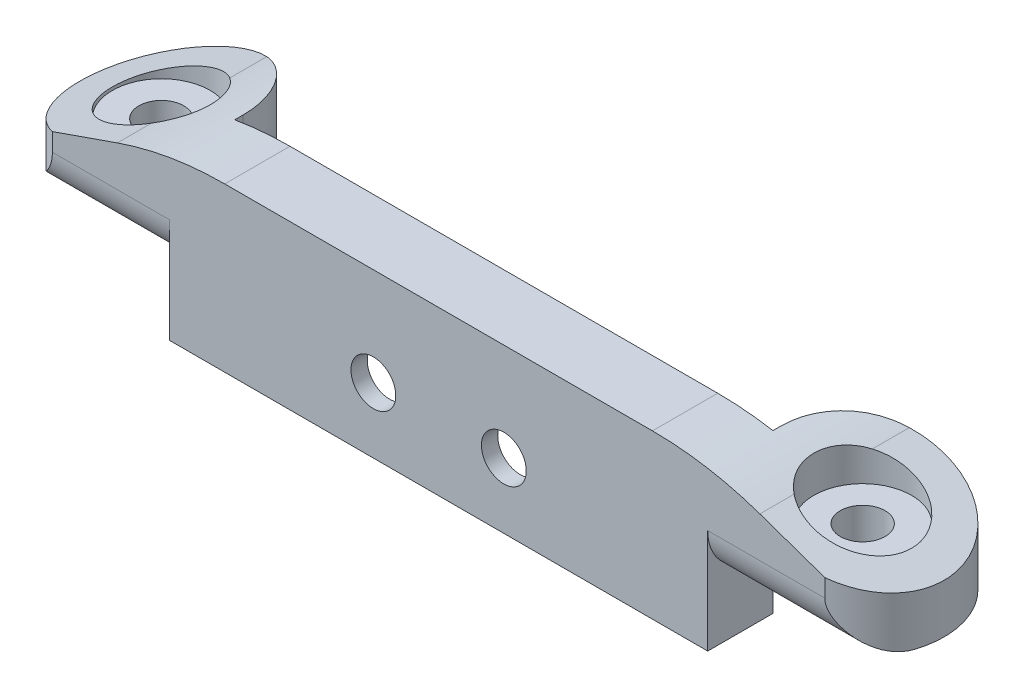
from build123d import *

# Parameters (mm, degrees)
SKETCH1_W               = 33
SKETCH1_H               = 20
BOSS_EXTRUDE1_DEPTH     = 4
BOSS_EXTRUDE2_START     = -13
BOSS_EXTRUDE2_DEPTH     = 13
FILLET2_R               = 5.8
CUT_EXTRUDE1_DEPTH      = 59.600341412
CUT_EXTRUDE1_DEPTH_BACK = 59.600341412
SKETCH3_R               = 2.75
CUT_EXTRUDE2_DEPTH      = 24.26
FILLET3_R               = 40
SKETCH5_R               = 6
CUT_EXTRUDE3_DEPTH      = 5.96
SKETCH7_W               = 48
SKETCH7_H               = 16
CUT_EXTRUDE6_DEPTH      = 6
FILLET4_R               = 8
FILLET5_R               = 2
CUT_EXTRUDE7_DEPTH      = 57.550862204
CUT_EXTRUDE7_DEPTH_BACK = 57.550862204
SKETCH8_R               = 2.75


with BuildPart() as part:
    # Sketch1 → Boss-Extrude1 (new, symmetric)
    with BuildSketch(Plane.XY):
        with Locations((16.5, 0)):
            Rectangle(SKETCH1_W, SKETCH1_H)
    extrude(amount=BOSS_EXTRUDE1_DEPTH, both=True)

    # Sketch2 → Boss-Extrude2 (add)
    with BuildSketch(Plane(origin=(0, 10, 0), x_dir=(1, 0, 0), z_dir=(0, 1, 0)).offset(BOSS_EXTRUDE2_START)):
        with BuildLine():
            Line((33, 5), (33, -4))
            Line((33, -4), (47.358898944, -4))
            ThreePointArc((47.358898944, -4), (48.310885546, 13.473163206), (33, 5))
        make_face()
    extrude(amount=BOSS_EXTRUDE2_DEPTH)

    # Fillet2
    fillet2_edges = [part.edges().sort_by_distance(p)[0] for p in [
        (40.179449472, -3, 4),
    ]]
    fillet(fillet2_edges, radius=FILLET2_R)

    # Sketch3 → Cut-Extrude1 (cut, two sides: drawn at the far end of the back side and taken through both)
    with BuildSketch(Plane(origin=(0, 10, 0), x_dir=(1, 0, 0), z_dir=(0, 1, 0)).offset(-CUT_EXTRUDE1_DEPTH_BACK)):
        with Locations(Location((43, 5, 0), (0, 0, 180))):
            Circle(SKETCH3_R)
    extrude(amount=CUT_EXTRUDE1_DEPTH + CUT_EXTRUDE1_DEPTH_BACK, mode=Mode.SUBTRACT)

    # Sketch4 → Cut-Extrude2 (cut)
    with BuildSketch(Plane.XY.offset(4)):
        Polygon((33, 10), (53, 3.02413209), (53, 10), align=None)
    extrude(amount=-CUT_EXTRUDE2_DEPTH, mode=Mode.SUBTRACT)

    # Fillet3
    # the kernel refuses this fillet: 40 mm, written as the material it takes off along each edge
    with BuildSketch(Plane(origin=(33, 10, 20.939258542), x_dir=(0.9442130463798117, -0.32933527452454203, 0), z_dir=(0, 0, -1))) as fillet3_piece_1:
        with BuildLine():
            CenterArc((FILLET3_R * 0.169392585415, FILLET3_R), FILLET3_R, 250.771565663, 19.228434337)
            Line((-FILLET3_R * 0.159942689109, FILLET3_R * 0.0557869536202), (0, 0))
            Line((0, 0), (FILLET3_R * 0.169392585415, 0))
        make_face()
    extrude(amount=41.878517083, mode=Mode.SUBTRACT)

    # Sketch5 → Cut-Extrude3 (cut)
    with BuildSketch(Plane(origin=(0, 10, 0), x_dir=(1, 0, 0), z_dir=(0, 1, 0))):
        with Locations(Location((43, 5, 0), (0, 0, 180))):
            Circle(SKETCH5_R)
    extrude(amount=-CUT_EXTRUDE3_DEPTH, mode=Mode.SUBTRACT)

    # Mirror2: part across plane


with BuildPart() as part_1:
    add(part.part)
    add(part.part.mirror(Plane(origin=(0, 10, 4), x_dir=(0, 0, 1), z_dir=(1, 0, 0))))

    # Sketch7 → Cut-Extrude6 (cut)
    with BuildSketch(Plane(origin=(0, 0, -4), x_dir=(-1, 0, 0), z_dir=(0, 0, -1))):
        with Locations((0, -2)):
            Rectangle(SKETCH7_W, SKETCH7_H)
    extrude(amount=-CUT_EXTRUDE6_DEPTH, mode=Mode.SUBTRACT)

    # Fillet4
    fillet4_edges = [part_1.edges().sort_by_distance(p)[0] for p in [
        (-24, 6, -1),
        (24, 6, -1),
    ]]
    fillet(fillet4_edges, radius=FILLET4_R)

    # Fillet5
    fillet5_edges = [part_1.edges().sort_by_distance(p)[0] for p in [
        (-24, -6, 2),
        (0, 6, 2),
        (24, -6, 2),
        (21.656854249, 3.656854249, 2),
        (-21.656854249, 3.656854249, 2),
    ]]
    fillet(fillet5_edges, radius=FILLET5_R)

    # Sketch8 → Cut-Extrude7 (cut, two sides: drawn at the far end of the back side and taken through both)
    with BuildSketch(Plane(origin=(0, 0, 2), x_dir=(-1, 0, 0), z_dir=(0, 0, -1)).offset(-CUT_EXTRUDE7_DEPTH_BACK)):
        with Locations((-8, -2)):
            Circle(SKETCH8_R)
        with Locations((8, -2)):
            Circle(SKETCH8_R)
    extrude(amount=CUT_EXTRUDE7_DEPTH + CUT_EXTRUDE7_DEPTH_BACK, mode=Mode.SUBTRACT)


solid = part_1.part
